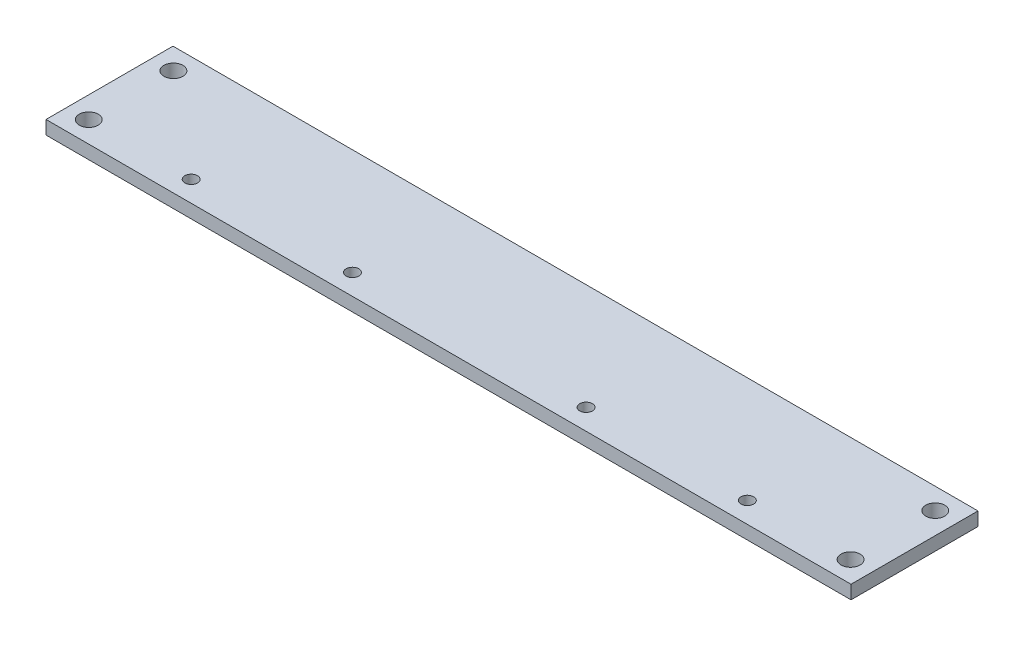
from build123d import *

# Parameters (mm, degrees)
SKETCH1_W           = 190.2
SKETCH1_H           = 30
BOSS_EXTRUDE1_DEPTH = 3.2
SKETCH2_R           = 2.25
CUT_EXTRUDE1_DEPTH  = 97.328863795
SKETCH3_R           = 1.5
CUT_EXTRUDE2_DEPTH  = 97.328863795


with BuildPart() as part:
    # Sketch1 → Boss-Extrude1 (new body)
    with BuildSketch(Plane(origin=(0, 0, 0), x_dir=(1, 0, 0), z_dir=(0, 1, 0))):
        Rectangle(SKETCH1_W, SKETCH1_H)
    extrude(amount=BOSS_EXTRUDE1_DEPTH)

    # Sketch2 → Cut-Extrude1 (cut, through all)
    with BuildSketch(Plane(origin=(0, 3.2, 0), x_dir=(1, 0, 0), z_dir=(0, 1, 0))):
        with Locations((-90, 10)):
            Circle(SKETCH2_R)
        with Locations((-90, -10)):
            Circle(SKETCH2_R)
        with Locations((90, 10)):
            Circle(SKETCH2_R)
        with Locations((90, -10)):
            Circle(SKETCH2_R)
    extrude(amount=-CUT_EXTRUDE1_DEPTH, mode=Mode.SUBTRACT)

    # Sketch3 → Cut-Extrude2 (cut, through all)
    with BuildSketch(Plane(origin=(0, 3.2, 0), x_dir=(1, 0, 0), z_dir=(0, 1, 0))):
        with Locations((65.7, -10.1)):
            Circle(SKETCH3_R)
        with Locations((27.6, -10.1)):
            Circle(SKETCH3_R)
        with Locations((-27.6, -10.1)):
            Circle(SKETCH3_R)
        with Locations((-65.7, -10.1)):
            Circle(SKETCH3_R)
    extrude(amount=-CUT_EXTRUDE2_DEPTH, mode=Mode.SUBTRACT)


solid = part.part
